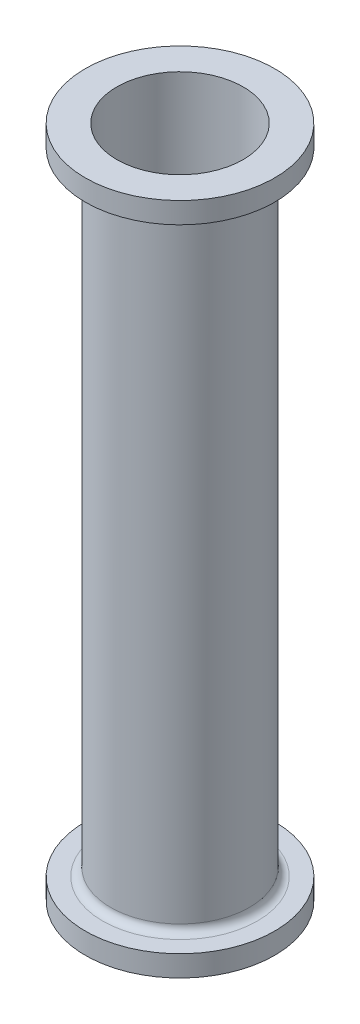
from build123d import *

# Parameters (mm, degrees)
SKETCH2_R            = 41.91
SKETCH2_R_2          = 38.1
BASE_CYLINDER_DEPTH  = 406.4
SKETCH3_R            = 57.15
SKETCH3_R_2          = 38.1
AFT_FLANGE_DEPTH     = 12.7
FORWARD_START        = -12.7
SKETCH4_R            = 57.15
SKETCH4_R_2          = 38.1
FORWARD_FLANGE_DEPTH = 12.7
FLANGE_FILLET_R      = 4.7625
SKETCH6_R            = 50.0761
SKETCH6_R_2          = 47.0027
AFT_O_RING_DEPTH     = 1.9812


with BuildPart() as part:
    # Sketch2 → Base Cylinder (new body)
    with BuildSketch(Plane(origin=(0, 0, 0), x_dir=(1, 0, 0), z_dir=(0, 1, 0))):
        Circle(SKETCH2_R)
        Circle(SKETCH2_R_2, mode=Mode.SUBTRACT)
    extrude(amount=BASE_CYLINDER_DEPTH)

    # Sketch3 → Aft Flange (add)
    with BuildSketch(Plane.XZ):
        Circle(SKETCH3_R)
        Circle(SKETCH3_R_2, mode=Mode.SUBTRACT)
    extrude(amount=-AFT_FLANGE_DEPTH)

    # Sketch4 → Forward Flange (add)
    with BuildSketch(Plane(origin=(0, 406.4, 0), x_dir=(1, 0, 0), z_dir=(0, 1, 0)).offset(FORWARD_START)):
        Circle(SKETCH4_R)
        Circle(SKETCH4_R_2, mode=Mode.SUBTRACT)
    extrude(amount=FORWARD_FLANGE_DEPTH)

    # Flange Fillet
    flange_fillet_edges = [part.edges().sort_by_distance(p)[0] for p in [
        (-41.91, 12.7, 0),
        (-41.91, 393.7, 0),
    ]]
    fillet(flange_fillet_edges, radius=FLANGE_FILLET_R)

    # Sketch6 → Aft O-Ring (cut)
    with BuildSketch(Plane.XZ):
        Circle(SKETCH6_R)
        Circle(SKETCH6_R_2, mode=Mode.SUBTRACT)
    extrude(amount=-AFT_O_RING_DEPTH, mode=Mode.SUBTRACT)


solid = part.part
